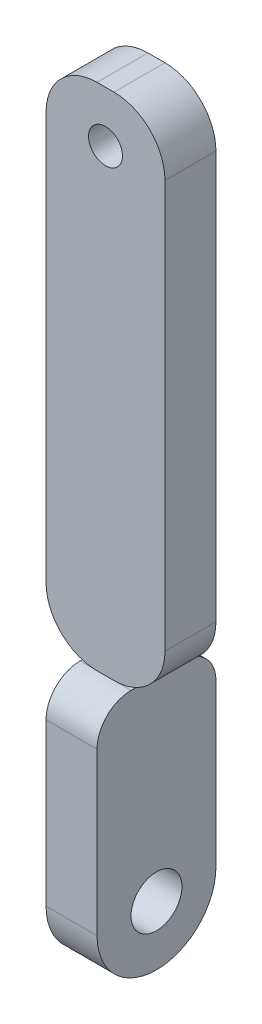
from build123d import *

# Parameters (mm, degrees)
SKETCH1_R           = 1
BOSS_EXTRUDE1_DEPTH = 1.5
BOSS_EXTRUDE2_DEPTH = 3.5
FILLET1_R           = 2
FILLET2_R           = 2
FILLET4_R           = 3.5
SKETCH2_R           = 1.5
CUT_EXTRUDE1_DEPTH  = 7


with BuildPart() as part:
    # Sketch1 → Boss-Extrude1 (new, symmetric)
    with BuildSketch(Plane.XY):
        with BuildLine():
            Line((3, 0), (4, 0))
            ThreePointArc((4, 0), (6.121320344, -0.878679656), (7, -3))
            Line((7, -3), (7, -27))
            ThreePointArc((7, -27), (6.121320344, -29.121320344), (4, -30))
            Line((4, -30), (3, -30))
            ThreePointArc((3, -30), (0.878679656, -29.121320344), (0, -27))
            Line((0, -27), (0, -3))
            ThreePointArc((0, -3), (0.878679656, -0.878679656), (3, 0))
        make_face()
        with Locations((3.5, -3)):
            Circle(SKETCH1_R, mode=Mode.SUBTRACT)
    extrude(amount=BOSS_EXTRUDE1_DEPTH, both=True)

    # Sketch1<3> → Boss-Extrude2 (add, symmetric)
    with BuildSketch(Plane.XY):
        Polygon((4, -30), (3, -30), (2, -30), (2, -45), (5, -45), (5, -30), align=None)
    extrude(amount=BOSS_EXTRUDE2_DEPTH, both=True)

    # Fillet1
    fillet1_edges = [part.edges().sort_by_distance(p)[0] for p in [
        (3.5, -30, 3.5),
    ]]
    fillet(fillet1_edges, radius=FILLET1_R - 0.0001)  # a hair under: the kernel refuses the full size

    # Fillet2
    fillet2_edges = [part.edges().sort_by_distance(p)[0] for p in [
        (3.5, -30, -3.5),
    ]]
    fillet(fillet2_edges, radius=FILLET2_R - 0.0001)  # a hair under: the kernel refuses the full size

    # Fillet4
    fillet4_edges = [part.edges().sort_by_distance(p)[0] for p in [
        (3.5, -45, 3.5),
        (3.5, -45, -3.5),
    ]]
    fillet(fillet4_edges, radius=FILLET4_R - 0.0001)  # a hair under: the kernel refuses the full size

    # Sketch2 → Cut-Extrude1 (cut)
    with BuildSketch(Plane(origin=(5, 0, 0), x_dir=(0, 0, -1), z_dir=(1, 0, 0))):
        with Locations(Location((0, -41.5, 0), (0, 0, 90))):
            Circle(SKETCH2_R)
    extrude(amount=-CUT_EXTRUDE1_DEPTH, mode=Mode.SUBTRACT)


solid = part.part
